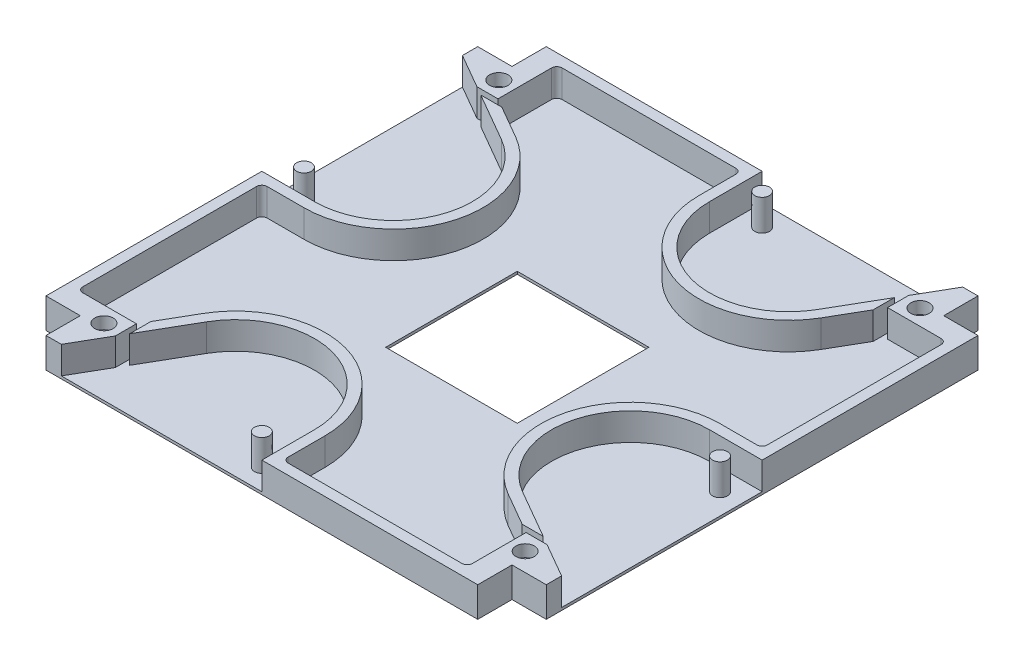
from build123d import *

# Parameters (mm, degrees)
BOSS_EXTRUDE1_DEPTH              = 0.5
BOSS_EXTRUDE2_DEPTH              = 5.2
CIRPATTERN1_COUNT                = 4
SKETCH8_R                        = 1.4
BOSS_EXTRUDE4_DEPTH              = 5.9
CIRPATTERN2_COUNT                = 4
FILLET1_R                        = 1
SKETCH11_W                       = 25
SKETCH11_H                       = 25
CUT_EXTRUDE2_DEPTH               = 126.311013881
SKETCH15_R                       = 0.9
CUT_EXTRUDE3_DEPTH               = 126.301756572
SKETCH16_R                       = 1.75
CUT_EXTRUDE4_DEPTH               = 2.3
CBORE_FOR_M1_6_SHCS2_D           = 1.8
CBORE_FOR_M1_6_SHCS2_CBORE_D     = 3.5
CBORE_FOR_M1_6_SHCS2_CBORE_DEPTH = 1.6


with BuildPart() as part:
    # Sketch1 → Boss-Extrude1 (new body)
    with BuildSketch(Plane(origin=(0, 0, 0), x_dir=(1, 0, 0), z_dir=(0, 1, 0))):
        Polygon((0, 0), (0, 6.51), (82, 6.51), (82, 0), (88.51, 0), (88.51, -82), (82, -82), (82, -88.51), (0, -88.51), (0, -82), (-6.51, -82), (-6.51, 0), align=None)
    extrude(amount=BOSS_EXTRUDE1_DEPTH)

    # Sketch2 → Boss-Extrude2 (add)
    with BuildSketch(Plane(origin=(0, 0.5, 0), x_dir=(1, 0, 0), z_dir=(0, 1, 0))):
        with BuildLine():
            Line((41, 6.51), (0, 6.51))
            Line((0, 6.51), (0, 4.51))
            Line((0, 4.51), (39, 4.51))
            Line((39, 4.51), (39, -3.49))
            ThreePointArc((39, -3.49), (51.600076233, -19.910739047), (70.722431864, -11.99))
            Line((70.722431864, -11.99), (73.026059438, -8))
            Line((73.026059438, -8), (74.335460515, -5.732050808))
            Line((74.335460515, -5.732050808), (74.335460515, -1.732050808))
            Line((74.335460515, -1.732050808), (68.990381057, -10.99))
            ThreePointArc((68.990381057, -10.99), (52.117714323, -17.978887394), (41, -3.49))
            Line((41, -3.49), (41, 6.51))
        make_face()
        Polygon((82, 6.51), (79.094010768, 6.51), (75.335460515, 0), (75.335460515, -4), (86.51, -4), (86.51, -41), (88.51, -41), (88.51, 0), (82, 0), align=None)
    boss_extrude2 = extrude(amount=BOSS_EXTRUDE2_DEPTH)

    # CirPattern1: Boss-Extrude2 ×4 about axis
    cirpattern1_axis = Axis((41, -0.325, 41), (0, 1, 0))
    for i in range(1, CIRPATTERN1_COUNT):
        add(boss_extrude2.rotate(cirpattern1_axis, i * 360 / CIRPATTERN1_COUNT))

    # Sketch8 → Boss-Extrude4 (add)
    with BuildSketch(Plane(origin=(0, 0.5, 0), x_dir=(1, 0, 0), z_dir=(0, 1, 0))):
        with Locations((37, -84.51)):
            Circle(SKETCH8_R)
    boss_extrude4 = extrude(amount=BOSS_EXTRUDE4_DEPTH)

    # CirPattern2: Boss-Extrude4 ×4 about axis
    cirpattern2_axis = Axis((41, -0.325, 41), (0, 1, 0))
    for i in range(1, CIRPATTERN2_COUNT):
        add(boss_extrude4.rotate(cirpattern2_axis, i * 360 / CIRPATTERN2_COUNT))

    # Fillet1
    fillet1_edges = [part.edges().sort_by_distance(p)[0] for p in [
        (-4.51, 3.1, 78),
        (-4.51, 3.1, 43),
        (4, 3.1, -4.51),
        (39, 3.1, -4.51),
        (86.51, 3.1, 4),
        (86.51, 3.1, 39),
        (78, 3.1, 86.51),
        (43, 3.1, 86.51),
    ]]
    fillet(fillet1_edges, radius=FILLET1_R)

    # Sketch11 → Cut-Extrude2 (cut, through all)
    with BuildSketch(Plane(origin=(0, 0.5, 0), x_dir=(1, 0, 0), z_dir=(0, 1, 0))):
        with Locations((41.5, -40.5)):
            Rectangle(SKETCH11_W, SKETCH11_H)
    extrude(amount=-CUT_EXTRUDE2_DEPTH, mode=Mode.SUBTRACT)

    # Sketch15 → Cut-Extrude3 (cut, through all)
    with BuildSketch(Plane(origin=(0, 5.7, 0), x_dir=(1, 0, 0), z_dir=(0, 1, 0))):
        with Locations((81, -78.5)):
            Circle(SKETCH15_R)
        with Locations((78.5, -1)):
            Circle(SKETCH15_R)
        with Locations((1, -3.5)):
            Circle(SKETCH15_R)
        with Locations((3.5, -81)):
            Circle(SKETCH15_R)
    extrude(amount=-CUT_EXTRUDE3_DEPTH, mode=Mode.SUBTRACT)

    # Sketch16 → Cut-Extrude4 (cut)
    with BuildSketch(Plane(origin=(0, 5.7, 0), x_dir=(1, 0, 0), z_dir=(0, 1, 0))):
        with Locations((78.5, -1)):
            Circle(SKETCH16_R)
        with Locations((81, -78.5)):
            Circle(SKETCH16_R)
        with Locations((3.5, -81)):
            Circle(SKETCH16_R)
        with Locations((1, -3.5)):
            Circle(SKETCH16_R)
    extrude(amount=-CUT_EXTRUDE4_DEPTH, mode=Mode.SUBTRACT)

    # CBORE for M1.6 SHCS2 (through all)
    with Locations(Plane(origin=(81, 0, 78.5), x_dir=(0, 0, -1), z_dir=(0, -1, 0))):
        with Locations((0, 0), (77.5, -2.5), (75, -80), (-2.5, -77.5)):
            CounterBoreHole(CBORE_FOR_M1_6_SHCS2_D / 2, CBORE_FOR_M1_6_SHCS2_CBORE_D / 2, CBORE_FOR_M1_6_SHCS2_CBORE_DEPTH)


solid = part.part
